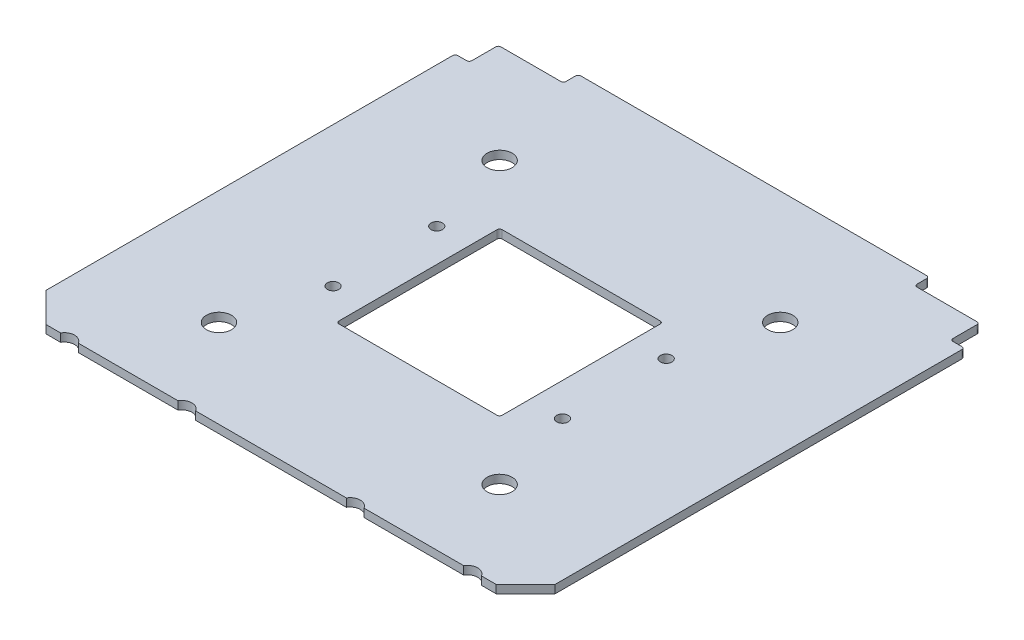
from build123d import *

# Parameters (mm, degrees)
GENERICCARDPCBDEFINITION_START = -0.8
GENERICCARDPCBDEFINITION_DEPTH = 1.6
CUT_EXTRUDE1_REACH             = 72.517
CUT_EXTRUDE2_REACH             = 72.517
SKETCH8_R                      = 2.4575
FILLET1_R                      = 0.5


# Read off the part's stored shape, not the designer's step: GenericCardPCBDefinition
with BuildPart() as part:
    # GenericCardPCBDefinition outline → GenericCardPCBDefinition (new body)
    with BuildSketch(Plane(origin=(0, 0, 0), x_dir=(1, 0, 0), z_dir=(0, 1, 0)).offset(GENERICCARDPCBDEFINITION_START)):
        with BuildLine():
            Line((-49.9, -39), (-44.1, -44.8))
            Line((-44.1, -44.8), (-41.232050808, -44.8))
            ThreePointArc((-41.232050808, -44.8), (-39.5, -43.8), (-37.767949192, -44.8))
            Line((-37.767949192, -44.8), (-18.232050808, -44.8))
            ThreePointArc((-18.232050808, -44.8), (-16.5, -43.8), (-14.767949192, -44.8))
            Line((-14.767949192, -44.8), (14.767949192, -44.8))
            ThreePointArc((14.767949192, -44.8), (16.5, -43.8), (18.232050808, -44.8))
            Line((18.232050808, -44.8), (37.767949192, -44.8))
            ThreePointArc((37.767949192, -44.8), (39.5, -43.8), (41.232050808, -44.8))
            Line((41.232050808, -44.8), (44.1, -44.8))
            Line((44.1, -44.8), (49.9, -39))
            Line((49.9, -39), (49.9, 40.7))
            ThreePointArc((49.9, 40.7), (49.753553391, 41.053553391), (49.4, 41.2))
            Line((49.4, 41.2), (47.65, 41.2))
            ThreePointArc((47.65, 41.2), (47.296446609, 41.346446609), (47.15, 41.7))
            Line((47.15, 41.7), (47.15, 46.4))
            ThreePointArc((47.15, 46.4), (47.003553391, 46.753553391), (46.65, 46.9))
            Line((46.65, 46.9), (34.9, 46.9))
            ThreePointArc((34.9, 46.9), (34.546446609, 47.046446609), (34.4, 47.4))
            Line((34.4, 47.4), (34.4, 49.3))
            ThreePointArc((34.4, 49.3), (34.253553391, 49.653553391), (33.9, 49.8))
            Line((33.9, 49.8), (-33.9, 49.8))
            ThreePointArc((-33.9, 49.8), (-34.253553391, 49.653553391), (-34.4, 49.3))
            Line((-34.4, 49.3), (-34.4, 47.4))
            ThreePointArc((-34.4, 47.4), (-34.546446609, 47.046446609), (-34.9, 46.9))
            Line((-34.9, 46.9), (-46.65, 46.9))
            ThreePointArc((-46.65, 46.9), (-47.003553391, 46.753553391), (-47.15, 46.4))
            Line((-47.15, 46.4), (-47.15, 41.7))
            ThreePointArc((-47.15, 41.7), (-47.296446609, 41.346446609), (-47.65, 41.2))
            Line((-47.65, 41.2), (-49.4, 41.2))
            ThreePointArc((-49.4, 41.2), (-49.753553391, 41.053553391), (-49.9, 40.7))
            Line((-49.9, 40.7), (-49.9, -39))
        make_face()
    extrude(amount=GENERICCARDPCBDEFINITION_DEPTH)

    # Sketch7 → Cut-Extrude1 (cut, up to next)
    with BuildSketch(Plane(origin=(0, 0.8, 0), x_dir=(1, 0, 0), z_dir=(0, 1, 0)), mode=Mode.PRIVATE) as cut_extrude1_sk1:
        Polygon((16, 14.5), (16, -14.5), (16, -16), (-14.25, -16), (-14.5, -16), (-16, -16), (-16, -14.5), (-16, 14.5), (-16, 16), (-14.5, 16), (-14.25, 16), (2.7929, 16), (3.75, 16), (16, 16), align=None)
    cut_extrude1_tool1 = extrude(cut_extrude1_sk1.sketch, amount=-CUT_EXTRUDE1_REACH, mode=Mode.PRIVATE) & part.part
    add(cut_extrude1_tool1.solids().sort_by_distance((0, 0.8, 0))[0], mode=Mode.SUBTRACT)

    # Sketch8 → Cut-Extrude2 (cut, up to next)
    with BuildSketch(Plane(origin=(0, 0.8, 0), x_dir=(1, 0, 0), z_dir=(0, 1, 0)), mode=Mode.PRIVATE) as cut_extrude2_sk1:
        with Locations(Location((27.5, 27.5, 0), (0, 0, 270))):
            Circle(SKETCH8_R)
    cut_extrude2_tool1 = extrude(cut_extrude2_sk1.sketch, amount=-CUT_EXTRUDE2_REACH, mode=Mode.PRIVATE) & part.part
    # Sketch8 → Cut-Extrude2 (cut, up to next)
    with BuildSketch(Plane(origin=(0, 0.8, 0), x_dir=(1, 0, 0), z_dir=(0, 1, 0)), mode=Mode.PRIVATE) as cut_extrude2_sk2:
        with Locations(Location((-27.5, -27.5, 0), (0, 0, 270))):
            Circle(SKETCH8_R)
    cut_extrude2_tool2 = extrude(cut_extrude2_sk2.sketch, amount=-CUT_EXTRUDE2_REACH, mode=Mode.PRIVATE) & part.part
    # Sketch8 → Cut-Extrude2 (cut, up to next)
    with BuildSketch(Plane(origin=(0, 0.8, 0), x_dir=(1, 0, 0), z_dir=(0, 1, 0)), mode=Mode.PRIVATE) as cut_extrude2_sk3:
        with Locations(Location((27.5, -27.5, 0), (0, 0, 180))):
            Circle(SKETCH8_R)
    cut_extrude2_tool3 = extrude(cut_extrude2_sk3.sketch, amount=-CUT_EXTRUDE2_REACH, mode=Mode.PRIVATE) & part.part
    # Sketch8 → Cut-Extrude2 (cut, up to next)
    with BuildSketch(Plane(origin=(0, 0.8, 0), x_dir=(1, 0, 0), z_dir=(0, 1, 0)), mode=Mode.PRIVATE) as cut_extrude2_sk4:
        with Locations(Location((-27.5, 27.5, 0), (0, 0, 180))):
            Circle(SKETCH8_R)
    cut_extrude2_tool4 = extrude(cut_extrude2_sk4.sketch, amount=-CUT_EXTRUDE2_REACH, mode=Mode.PRIVATE) & part.part
    # Sketch8 → Cut-Extrude2 (cut, up to next)
    with BuildSketch(Plane(origin=(0, 0.8, 0), x_dir=(1, 0, 0), z_dir=(0, 1, 0)), mode=Mode.PRIVATE) as cut_extrude2_sk5:
        with BuildLine():
            ThreePointArc((-22.495277655, 11.290382806), (-23.6095, 10.16), (-22.495277655, 9.029617194))
            ThreePointArc((-22.495277655, 9.029617194), (-21.3485, 10.16), (-22.495277655, 11.290382806))
        make_face()
    cut_extrude2_tool5 = extrude(cut_extrude2_sk5.sketch, amount=-CUT_EXTRUDE2_REACH, mode=Mode.PRIVATE) & part.part
    # Sketch8 → Cut-Extrude2 (cut, up to next)
    with BuildSketch(Plane(origin=(0, 0.8, 0), x_dir=(1, 0, 0), z_dir=(0, 1, 0)), mode=Mode.PRIVATE) as cut_extrude2_sk6:
        with BuildLine():
            ThreePointArc((-22.504884895, -9.02979638), (-23.609238096, -10.135666951), (-22.553502979, -11.288042356))
            ThreePointArc((-22.553502979, -11.288042356), (-21.348761904, -10.184333049), (-22.504884895, -9.02979638))
        make_face()
    cut_extrude2_tool6 = extrude(cut_extrude2_sk6.sketch, amount=-CUT_EXTRUDE2_REACH, mode=Mode.PRIVATE) & part.part
    # Sketch8 → Cut-Extrude2 (cut, up to next)
    with BuildSketch(Plane(origin=(0, 0.8, 0), x_dir=(1, 0, 0), z_dir=(0, 1, 0)), mode=Mode.PRIVATE) as cut_extrude2_sk7:
        with BuildLine():
            ThreePointArc((22.479, 11.2905), (23.6095, 10.16), (22.479, 9.0295))
            ThreePointArc((22.479, 9.0295), (21.3485, 10.16), (22.479, 11.2905))
        make_face()
    cut_extrude2_tool7 = extrude(cut_extrude2_sk7.sketch, amount=-CUT_EXTRUDE2_REACH, mode=Mode.PRIVATE) & part.part
    # Sketch8 → Cut-Extrude2 (cut, up to next)
    with BuildSketch(Plane(origin=(0, 0.8, 0), x_dir=(1, 0, 0), z_dir=(0, 1, 0)), mode=Mode.PRIVATE) as cut_extrude2_sk8:
        with BuildLine():
            ThreePointArc((22.479, -9.0295), (23.6095, -10.16), (22.479, -11.2905))
            ThreePointArc((22.479, -11.2905), (21.3485, -10.16), (22.479, -9.0295))
        make_face()
    cut_extrude2_tool8 = extrude(cut_extrude2_sk8.sketch, amount=-CUT_EXTRUDE2_REACH, mode=Mode.PRIVATE) & part.part
    add(cut_extrude2_tool1.solids().sort_by_distance((27.5, 0.8, -27.5))[0], mode=Mode.SUBTRACT)
    add(cut_extrude2_tool2.solids().sort_by_distance((-27.5, 0.8, 27.5))[0], mode=Mode.SUBTRACT)
    add(cut_extrude2_tool3.solids().sort_by_distance((27.5, 0.8, 27.5))[0], mode=Mode.SUBTRACT)
    add(cut_extrude2_tool4.solids().sort_by_distance((-27.5, 0.8, -27.5))[0], mode=Mode.SUBTRACT)
    add(cut_extrude2_tool5.solids().sort_by_distance((-22.479, 0.8, -10.16))[0], mode=Mode.SUBTRACT)
    add(cut_extrude2_tool6.solids().sort_by_distance((-22.479, 0.8, 10.16))[0], mode=Mode.SUBTRACT)
    add(cut_extrude2_tool7.solids().sort_by_distance((22.479, 0.8, -10.16))[0], mode=Mode.SUBTRACT)
    add(cut_extrude2_tool8.solids().sort_by_distance((22.479, 0.8, 10.16))[0], mode=Mode.SUBTRACT)

    # Fillet1
    fillet1_edges = [part.edges().sort_by_distance(p)[0] for p in [
        (16, 0, -16),
        (16, 0, 16),
        (-16, 0, 16),
        (-16, 0, -16),
    ]]
    fillet(fillet1_edges, radius=FILLET1_R)


solid = part.part
